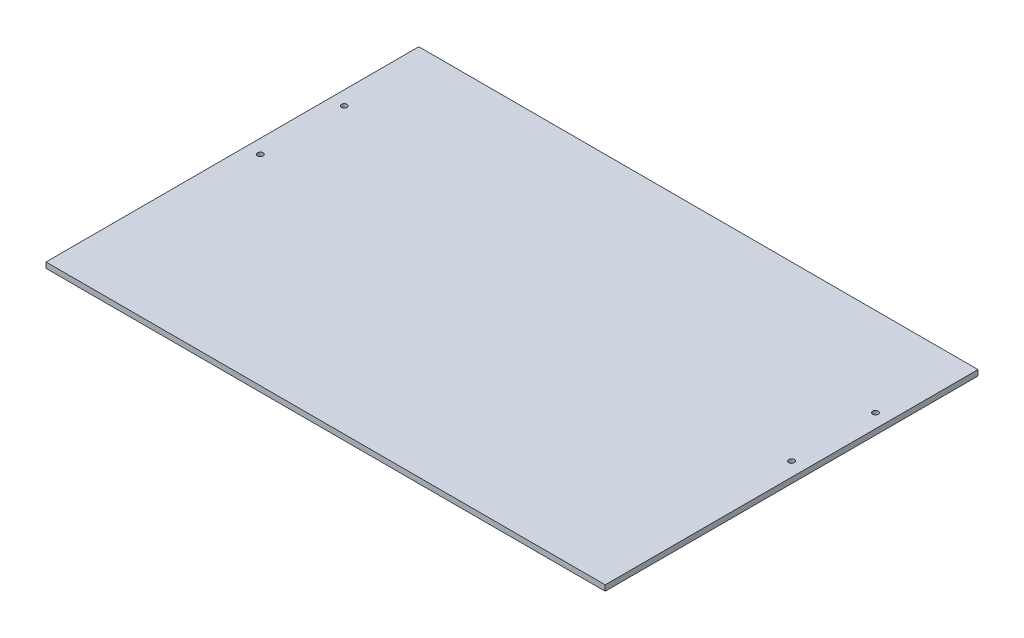
from build123d import *

# Parameters (mm, degrees)
ESBO_O1_W                = 300
ESBO_O1_H                = 200
ESBO_O1_R                = 1.5
RESSALTO_EXTRUS_O1_DEPTH = 3


with BuildPart() as part:
    # Esboço1 → Ressalto-extrusão1 (new body)
    with BuildSketch(Plane(origin=(0, 0, 0), x_dir=(1, 0, 0), z_dir=(0, 1, 0))):
        Rectangle(ESBO_O1_W, ESBO_O1_H)
        with Locations((-142.5, 52.5)):
            Circle(ESBO_O1_R, mode=Mode.SUBTRACT)
        with Locations((-142.5, 7.5)):
            Circle(ESBO_O1_R, mode=Mode.SUBTRACT)
        with Locations((142.5, 7.5)):
            Circle(ESBO_O1_R, mode=Mode.SUBTRACT)
        with Locations((142.5, 52.5)):
            Circle(ESBO_O1_R, mode=Mode.SUBTRACT)
    extrude(amount=RESSALTO_EXTRUS_O1_DEPTH)


solid = part.part
